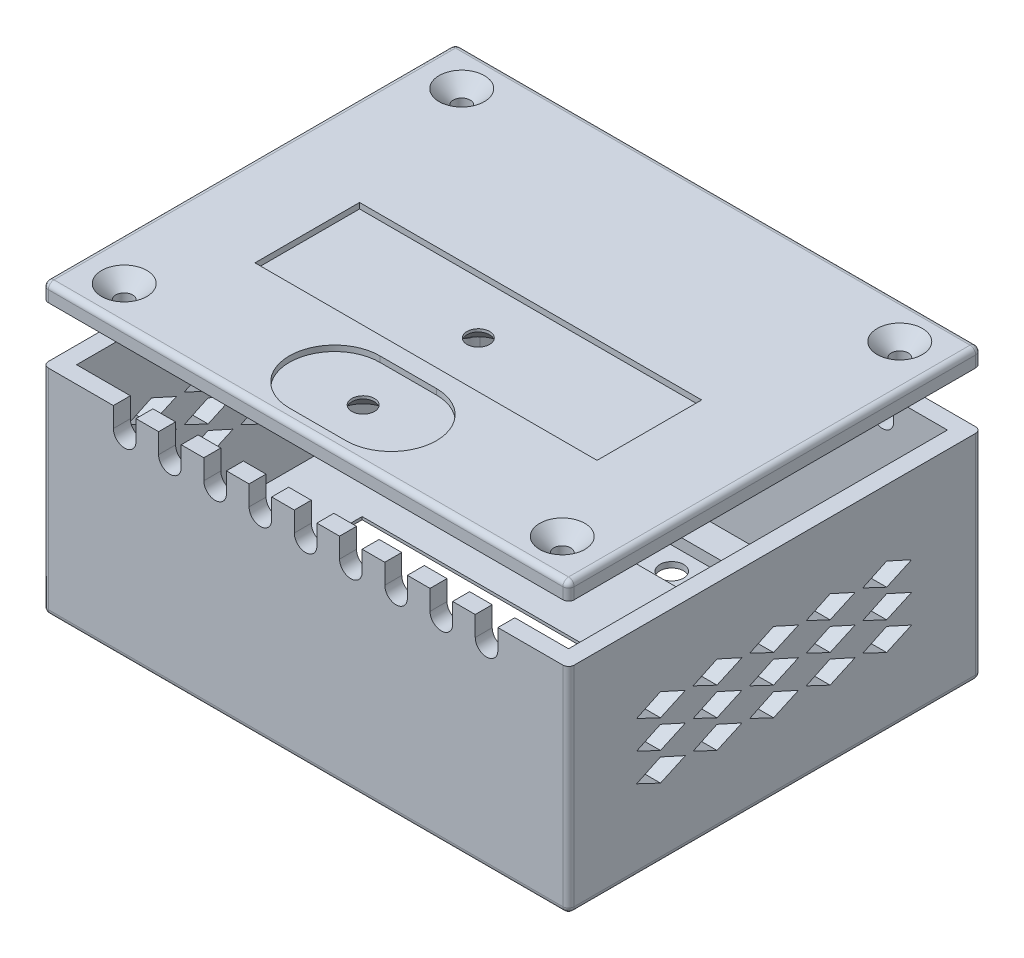
from build123d import *
from OCP.BRepFilletAPI import BRepFilletAPI_MakeChamfer

# Parameters (mm, degrees)
SKETCH_227_W            = 93
SKETCH_227_H            = 73
SKETCH_227_W_2          = 87
SKETCH_227_H_2          = 67
EXTRUDE_477_DEPTH       = 35
SKETCH_2_W              = 93
SKETCH_2_H              = 73
EXTRUDE_524_DEPTH       = 3
SKETCH_1_W              = 60
SKETCH_1_H              = 31
CUT_EXTRUDE_2861_DEPTH  = 3
EXTRUDE_3757_DEPTH      = 2
EXTRUDE_3757_DEPTH_BACK = 3
SKETCH_2_2_R            = 3
SKETCH_2_2_R_2          = 1.5
CHAMFER_3816_SIZE       = 2.5
CHAMFER_3816_SIZE2      = 3
SKETCH_1_3_W            = 28
SKETCH_1_3_H            = 8
CUT_EXTRUDE_1_DEPTH     = 2
SKETCH_1_4_R            = 2.1
CUT_EXTRUDE_2_DEPTH     = 69.698617162
SKETCH_1_5_R            = 1.25
EXTRUDE_3_DEPTH         = 5
FILLET_4_R              = 1
SKETCH_4282_R           = 1.5
EXTRUDE_5048_DEPTH      = 12
CUT_EXTRUDE_6380_DEPTH  = 129.932152701
CUT_EXTRUDE_7651_DEPTH  = 94.360859036
FILLET_2_R              = 1
SKETCH_7_W              = 93
SKETCH_7_H              = 73
SKETCH_7_R              = 1.5
EXTRUDE_8347_DEPTH      = 3
EXTRUDE_START           = -1
SKETCH_7_3_W            = 86
SKETCH_7_3_H            = 66
SKETCH_7_3_R            = 1.5
EXTRUDE_2_DEPTH         = 1
FILLET_3_R              = 1
CHAMFER_2_SIZE          = 2.5
SKETCH_4_W              = 60.5
SKETCH_4_H              = 18.5
CUT_EXTRUDE_1_2_DEPTH   = 1
SKETCH_4_3_R            = 2
CUT_EXTRUDE_2_2_DEPTH   = 5
CHAMFER_3_SIZE          = 2.5
SKETCH_8_W              = 2.198076923
SKETCH_8_H              = 1.058333334
CUT_EXTRUDE_10181_DEPTH = 1


with BuildPart() as part:
    # Sketch 227 → Extrude 477 (new body)
    with BuildSketch(Plane(origin=(0, 0, 0), x_dir=(1, 0, 0), z_dir=(0, 1, 0))):
        Rectangle(SKETCH_227_W, SKETCH_227_H)
        Rectangle(SKETCH_227_W_2, SKETCH_227_H_2, mode=Mode.SUBTRACT)
    extrude(amount=EXTRUDE_477_DEPTH)

    # Sketch 2 → Extrude 524 (add)
    with BuildSketch(Plane(origin=(0, 0, 0), x_dir=(1, 0, 0), z_dir=(0, 1, 0))):
        Rectangle(SKETCH_2_W, SKETCH_2_H)
    extrude(amount=-EXTRUDE_524_DEPTH)

    # Экран1 → Cut-Extrude 2861 (cut)
    with BuildSketch(Plane.XZ):
        with Locations((0, 12)):
            Rectangle(SKETCH_1_W, SKETCH_1_H)
    extrude(amount=CUT_EXTRUDE_2861_DEPTH, mode=Mode.SUBTRACT)

    # Sketch 2 2 → Extrude 3757 (add, two sides: drawn at the far end of the back side and taken through both)
    # profile 1 of 4: a face of its own
    with BuildSketch(Plane.XZ.offset(-EXTRUDE_3757_DEPTH_BACK)):
        with Locations((-32.75, -12.5)):
            Circle(SKETCH_2_2_R)
        with Locations((-32.75, -12.5)):
            Circle(SKETCH_2_2_R_2, mode=Mode.SUBTRACT)
    # profile 2 of 4: a face of its own
    with BuildSketch(Plane.XZ.offset(-EXTRUDE_3757_DEPTH_BACK)):
        with Locations((32.75, -12.5)):
            Circle(SKETCH_2_2_R)
        with Locations((32.75, -12.5)):
            Circle(SKETCH_2_2_R_2, mode=Mode.SUBTRACT)
    # profile 3 of 4: a face of its own
    with BuildSketch(Plane.XZ.offset(-EXTRUDE_3757_DEPTH_BACK)):
        with BuildLine():
            Line((29.75, 30.5), (29.75, 35.108230604))
            Line((29.75, 35.108230604), (35.75, 35.108230604))
            Line((35.75, 35.108230604), (35.75, 30.5))
            ThreePointArc((35.75, 30.5), (32.75, 27.5), (29.75, 30.5))
        make_face()
        with Locations((32.75, 30.5)):
            Circle(SKETCH_2_2_R_2, mode=Mode.SUBTRACT)
    # profile 4 of 4: a face of its own
    with BuildSketch(Plane.XZ.offset(-EXTRUDE_3757_DEPTH_BACK)):
        with BuildLine():
            Line((-35.75, 30.5), (-35.75, 35.108230604))
            Line((-35.75, 35.108230604), (-29.75, 35.108230604))
            Line((-29.75, 35.108230604), (-29.75, 30.5))
            ThreePointArc((-29.75, 30.5), (-32.75, 27.5), (-35.75, 30.5))
        make_face()
        with Locations((-32.75, 30.5)):
            Circle(SKETCH_2_2_R_2, mode=Mode.SUBTRACT)
    extrude(amount=EXTRUDE_3757_DEPTH + EXTRUDE_3757_DEPTH_BACK)

    # Chamfer 3816: one chamfer whose edges measure the first distance from different faces: ONE call of the kernel's chamfer builder (chamfer() names one face for all edges)
    chamfer_3816_edges_1 = [part.edges().sort_by_distance(p)[0] for p in [
        (0, -3, -3.5),
    ]]
    chamfer_3816_side_1 = [part.faces().sort_by_distance(p)[0] for p in [
        (0, -1.5, -3.5),
    ]]
    chamfer_3816_edges_2 = [part.edges().sort_by_distance(p)[0] for p in [
        (-30, -3, 12),
    ]]
    chamfer_3816_side_2 = [part.faces().sort_by_distance(p)[0] for p in [
        (-30, -1.5, 12),
    ]]
    chamfer_3816_edges_3 = [part.edges().sort_by_distance(p)[0] for p in [
        (30, -3, 12),
    ]]
    chamfer_3816_side_3 = [part.faces().sort_by_distance(p)[0] for p in [
        (30, -1.5, 12),
    ]]
    chamfer_3816_edges_4 = [part.edges().sort_by_distance(p)[0] for p in [
        (0, -3, 27.5),
    ]]
    chamfer_3816_side_4 = [part.faces().sort_by_distance(p)[0] for p in [
        (0, -1.5, 27.5),
    ]]
    chamfer_3816 = BRepFilletAPI_MakeChamfer(part.part.solid().wrapped)
    for e in chamfer_3816_edges_1:
        chamfer_3816.Add(CHAMFER_3816_SIZE, CHAMFER_3816_SIZE2, e.wrapped, chamfer_3816_side_1[0].wrapped)  # the first distance lies on this face
    for e in chamfer_3816_edges_2:
        chamfer_3816.Add(CHAMFER_3816_SIZE, CHAMFER_3816_SIZE2, e.wrapped, chamfer_3816_side_2[0].wrapped)  # the first distance lies on this face
    for e in chamfer_3816_edges_3:
        chamfer_3816.Add(CHAMFER_3816_SIZE, CHAMFER_3816_SIZE2, e.wrapped, chamfer_3816_side_3[0].wrapped)  # the first distance lies on this face
    for e in chamfer_3816_edges_4:
        chamfer_3816.Add(CHAMFER_3816_SIZE, CHAMFER_3816_SIZE2, e.wrapped, chamfer_3816_side_4[0].wrapped)  # the first distance lies on this face
    add(Compound.cast(chamfer_3816.Shape()), mode=Mode.REPLACE)

    # Экран1<3> → Cut-Extrude 1 (cut)
    with BuildSketch(Plane.XZ):
        with Locations((0, -24.5)):
            Rectangle(SKETCH_1_3_W, SKETCH_1_3_H)
    extrude(amount=CUT_EXTRUDE_1_DEPTH, mode=Mode.SUBTRACT)

    # Экран1<4> → Cut-Extrude 2 (cut, through all)
    with BuildSketch(Plane.XZ):
        with Locations((-11, -24.5)):
            Circle(SKETCH_1_4_R)
        with Locations((-3.75, -24.5)):
            Circle(SKETCH_1_4_R)
        with Locations((11, -24.5)):
            Circle(SKETCH_1_4_R)
        with Locations((3.75, -24.5)):
            Circle(SKETCH_1_4_R)
    extrude(amount=CUT_EXTRUDE_2_DEPTH, mode=Mode.SUBTRACT)

    # Экран1<5> → КН3 (add)
    with BuildSketch(Plane.XZ):
        with Locations((-16.5, -19)):
            Circle(SKETCH_1_5_R)
        with Locations((16.5, -19)):
            Circle(SKETCH_1_5_R)
        with Locations((16.5, -30)):
            Circle(SKETCH_1_5_R)
        with Locations((-16.5, -30)):
            Circle(SKETCH_1_5_R)
    extrude(amount=-EXTRUDE_3_DEPTH)

    # КН4
    fillet_4_edges = [part.edges().sort_by_distance(p)[0] for p in [
        (-17.75, 5, -30),
        (-17.75, 5, -19),
        (15.25, 5, -30),
        (15.25, 5, -19),
    ]]
    fillet(fillet_4_edges, radius=FILLET_4_R)

    # Sketch 4282 → Extrude 5048 (add)
    # profile 1 of 4: a face of its own
    with BuildSketch(Plane(origin=(0, 0, 0), x_dir=(1, 0, 0), z_dir=(0, 1, 0))):
        with BuildLine():
            Line((-35.485, -29.845), (-35.485, -34.239974432))
            Line((-35.485, -34.239974432), (-44.325235743, -34.239974432))
            Line((-44.325235743, -34.239974432), (-44.325235743, -26.595))
            Line((-44.325235743, -26.595), (-38.735, -26.595))
            ThreePointArc((-38.735, -26.595), (-36.436902961, -27.546902961), (-35.485, -29.845))
        make_face()
        with Locations((-38.735, -29.845)):
            Circle(SKETCH_4282_R, mode=Mode.SUBTRACT)
    # profile 2 of 4: a face of its own
    with BuildSketch(Plane(origin=(0, 0, 0), x_dir=(1, 0, 0), z_dir=(0, 1, 0))):
        with BuildLine():
            Line((44.325235743, -26.595), (44.325235743, -34.239974432))
            Line((44.325235743, -34.239974432), (35.485, -34.239974432))
            Line((35.485, -34.239974432), (35.485, -29.845))
            ThreePointArc((35.485, -29.845), (36.436902961, -27.546902961), (38.735, -26.595))
            Line((38.735, -26.595), (44.325235743, -26.595))
        make_face()
        with Locations((38.735, -29.845)):
            Circle(SKETCH_4282_R, mode=Mode.SUBTRACT)
    # profile 3 of 4: a face of its own
    with BuildSketch(Plane(origin=(0, 0, 0), x_dir=(1, 0, 0), z_dir=(0, 1, 0))):
        with BuildLine():
            Line((35.485, 29.845), (35.485, 34.239974432))
            Line((35.485, 34.239974432), (44.325235743, 34.239974432))
            Line((44.325235743, 34.239974432), (44.325235743, 26.595))
            Line((44.325235743, 26.595), (38.735, 26.595))
            ThreePointArc((38.735, 26.595), (36.436902961, 27.546902961), (35.485, 29.845))
        make_face()
        with Locations((38.735, 29.845)):
            Circle(SKETCH_4282_R, mode=Mode.SUBTRACT)
    # profile 4 of 4: a face of its own
    with BuildSketch(Plane(origin=(0, 0, 0), x_dir=(1, 0, 0), z_dir=(0, 1, 0))):
        with BuildLine():
            Line((-44.325235743, 26.595), (-44.325235743, 34.239974432))
            Line((-44.325235743, 34.239974432), (-35.485, 34.239974432))
            Line((-35.485, 34.239974432), (-35.485, 29.845))
            ThreePointArc((-35.485, 29.845), (-36.436902961, 27.546902961), (-38.735, 26.595))
            Line((-38.735, 26.595), (-44.325235743, 26.595))
        make_face()
        with Locations((-38.735, 29.845)):
            Circle(SKETCH_4282_R, mode=Mode.SUBTRACT)
    extrude(amount=EXTRUDE_5048_DEPTH)

    # Sketch 5098 → Cut-Extrude 6380 (cut, through all)
    with BuildSketch(Plane(origin=(-46.5, -46.5, 0), x_dir=(0, -1, 0), z_dir=(1, 0, 0))):
        Polygon((-57.799499658, -14.466543213), (-55.799499658, -10.243903766), (-57.799499658, -5.835537696), (-59.799499658, -10.243903766), align=None)
        Polygon((-57.799499658, -24.466543213), (-55.799499658, -20.243903766), (-57.799499658, -15.835537696), (-59.799499658, -20.243903766), align=None)
        Polygon((-62.799499658, -24.466543213), (-60.799499658, -20.243903766), (-62.799499658, -15.835537696), (-64.799499658, -20.243903766), align=None)
        Polygon((-67.799499658, -24.466543213), (-65.799499658, -20.243903766), (-67.799499658, -15.835537696), (-69.799499658, -20.243903766), align=None)
        Polygon((-62.799499658, -14.466543213), (-60.799499658, -10.243903766), (-62.799499658, -5.835537696), (-64.799499658, -10.243903766), align=None)
        Polygon((-67.799499658, -14.466543213), (-65.799499658, -10.243903766), (-67.799499658, -5.835537696), (-69.799499658, -10.243903766), align=None)
        Polygon((-57.799499658, -4.466543213), (-55.799499658, -0.243903766), (-57.799499658, 4.164462304), (-59.799499658, -0.243903766), align=None)
        Polygon((-62.799499658, -4.466543213), (-60.799499658, -0.243903766), (-62.799499658, 4.164462304), (-64.799499658, -0.243903766), align=None)
        Polygon((-67.799499658, -4.466543213), (-65.799499658, -0.243903766), (-67.799499658, 4.164462304), (-69.799499658, -0.243903766), align=None)
        Polygon((-57.799499658, 5.533456787), (-55.799499658, 9.756096234), (-57.799499658, 14.164462304), (-59.799499658, 9.756096234), align=None)
        Polygon((-62.799499658, 5.533456787), (-60.799499658, 9.756096234), (-62.799499658, 14.164462304), (-64.799499658, 9.756096234), align=None)
        Polygon((-67.799499658, 5.533456787), (-65.799499658, 9.756096234), (-67.799499658, 14.164462304), (-69.799499658, 9.756096234), align=None)
        Polygon((-57.799499658, 15.533456787), (-55.799499658, 19.756096234), (-57.799499658, 24.164462304), (-59.799499658, 19.756096234), align=None)
        Polygon((-62.799499658, 15.533456787), (-60.799499658, 19.756096234), (-62.799499658, 24.164462304), (-64.799499658, 19.756096234), align=None)
        Polygon((-67.799499658, 15.533456787), (-65.799499658, 19.756096234), (-67.799499658, 24.164462304), (-69.799499658, 19.756096234), align=None)
    extrude(amount=CUT_EXTRUDE_6380_DEPTH, mode=Mode.SUBTRACT)

    # Эскиз6 → Cut-Extrude 7651 (cut, through all)
    with BuildSketch(Plane(origin=(0, 0, -36.5), x_dir=(-1, 0, 0), z_dir=(0, 0, -1))):
        with BuildLine():
            Line((2, 31.480713366), (2, 35))
            Line((2, 35), (-2, 35))
            Line((-2, 35), (-2, 31.480713366))
            ThreePointArc((-2, 31.480713366), (0, 29.480713366), (2, 31.480713366))
        make_face()
        with BuildLine():
            Line((10, 31.480713366), (10, 35))
            Line((10, 35), (6, 35))
            Line((6, 35), (6, 31.480713366))
            ThreePointArc((6, 31.480713366), (8, 29.480713366), (10, 31.480713366))
        make_face()
        with BuildLine():
            Line((18, 31.480713366), (18, 35))
            Line((18, 35), (14, 35))
            Line((14, 35), (14, 31.480713366))
            ThreePointArc((14, 31.480713366), (16, 29.480713366), (18, 31.480713366))
        make_face()
        with BuildLine():
            Line((26, 31.480713366), (26, 35))
            Line((26, 35), (22, 35))
            Line((22, 35), (22, 31.480713366))
            ThreePointArc((22, 31.480713366), (24, 29.480713366), (26, 31.480713366))
        make_face()
        with BuildLine():
            Line((34, 31.480713366), (34, 35))
            Line((34, 35), (30, 35))
            Line((30, 35), (30, 31.480713366))
            ThreePointArc((30, 31.480713366), (32, 29.480713366), (34, 31.480713366))
        make_face()
        with BuildLine():
            Line((-6, 31.480713366), (-6, 35))
            Line((-6, 35), (-10, 35))
            Line((-10, 35), (-10, 31.480713366))
            ThreePointArc((-10, 31.480713366), (-8, 29.480713366), (-6, 31.480713366))
        make_face()
        with BuildLine():
            Line((-14, 31.480713366), (-14, 35))
            Line((-14, 35), (-18, 35))
            Line((-18, 35), (-18, 31.480713366))
            ThreePointArc((-18, 31.480713366), (-16, 29.480713366), (-14, 31.480713366))
        make_face()
        with BuildLine():
            Line((-22, 31.480713366), (-22, 35))
            Line((-22, 35), (-26, 35))
            Line((-26, 35), (-26, 31.480713366))
            ThreePointArc((-26, 31.480713366), (-24, 29.480713366), (-22, 31.480713366))
        make_face()
        with BuildLine():
            Line((-30, 31.480713366), (-30, 35))
            Line((-30, 35), (-34, 35))
            Line((-34, 35), (-34, 31.480713366))
            ThreePointArc((-34, 31.480713366), (-32, 29.480713366), (-30, 31.480713366))
        make_face()
    extrude(amount=-CUT_EXTRUDE_7651_DEPTH, mode=Mode.SUBTRACT)

    # Скругление2
    fillet_2_edges = [part.edges().sort_by_distance(p)[0] for p in [
        (-46.5, 16, 36.5),
        (-46.5, 16, -36.5),
        (46.5, 16, -36.5),
        (46.5, 16, 36.5),
        (46.5, -3, 0),
        (0, -3, 36.5),
        (-46.5, -3, 0),
        (0, -3, -36.5),
    ]]
    fillet(fillet_2_edges, radius=FILLET_2_R)

    # Эскиз8 → Cut-Extrude 10181 (cut)
    with BuildSketch(Plane.XZ.offset(3)):
        with Locations((-10.962688555, -15.117212682)):
            Rectangle(SKETCH_8_W, SKETCH_8_H)
        Polygon((-4.571983426, -13.855353708), (-4.571983426, -12.308558836), (-3.513650093, -12.308558836), (-3.513650093, -13.855353708), (-1.885444964, -13.855353708), (-1.885444964, -14.913687041), (-3.513650093, -14.913687041), (-3.513650093, -16.460481913), (-4.571983426, -16.460481913), (-4.571983426, -14.913687041), (-6.200188554, -14.913687041), (-6.200188554, -13.855353708), align=None)
        Polygon((1.778016574, -11.08740499), (5.197247343, -11.08740499), (5.197247343, -12.227148579), (2.917760164, -12.227148579), (2.917760164, -13.448302426), (5.197247343, -13.448302426), (5.197247343, -14.588046015), (2.917760164, -14.588046015), (2.917760164, -16.2976614), (5.197247343, -16.2976614), (5.197247343, -17.43740499), (1.778016574, -17.43740499), align=None)
        with BuildLine():
            Line((12.035708882, -11.935852506), (11.18344526, -12.715610118))
            add(Edge.make_bspline(
                [(11.18344526, -12.715610118), (11.115240811, -12.615550509), (11.008085728, -12.477394122), (10.850124863, -12.319945746), (10.73652598, -12.226881626), (10.621344292, -12.154472729), (10.469317172, -12.086967955), (10.349028438, -12.064069056), (10.270123946, -12.064328067)],
                knots=[0, 0, 0, 0, 0.31182434, 0.448432767, 0.573381197, 0.689077147, 0.797572901, 1, 1, 1, 1], degree=3))
            add(Edge.make_bspline(
                [(10.270123946, -12.064328067), (10.200756629, -12.064216406), (10.097367838, -12.07659847), (9.976136925, -12.134449077), (9.89898156, -12.189349936), (9.837949237, -12.255546776), (9.773768086, -12.346429195), (9.756826865, -12.428031448), (9.756221702, -12.480283595)],
                knots=[0, 0, 0, 0, 0.285992887, 0.416634394, 0.547379946, 0.671582838, 0.784400739, 1, 1, 1, 1], degree=3))
            add(Edge.make_bspline(
                [(9.756221702, -12.480283595), (9.755439866, -12.533591008), (9.775703689, -12.642360428), (9.828641503, -12.739272153), (9.861800628, -12.784300022)],
                knots=[0, 0, 0, 0, 0.487115475, 1, 1, 1, 1], degree=3))
            add(Edge.make_bspline(
                [(9.861800628, -12.784300022), (9.894291342, -12.827692703), (9.957541757, -12.89570312), (10.054651171, -12.994699744), (10.154583283, -13.089388399), (10.269935168, -13.199711266), (10.462336858, -13.371950384), (10.615262197, -13.508617667), (10.724240532, -13.603490727)],
                knots=[0, 0, 0, 0, 0.136349281, 0.233805212, 0.349411224, 0.48317915, 0.635966856, 1, 1, 1, 1], degree=3))
            add(Edge.make_bspline(
                [(10.724240532, -13.603490727), (10.825342822, -13.691530368), (10.970308098, -13.815212262), (11.150016864, -13.973999674), (11.261144287, -14.071853987), (11.354942775, -14.156575621), (11.447206517, -14.24283398), (11.507829464, -14.300959754), (11.542159202, -14.336183035)],
                knots=[0, 0, 0, 0, 0.366184141, 0.520457298, 0.655012135, 0.770624226, 0.865677185, 1, 1, 1, 1], degree=3))
            add(Edge.make_bspline(
                [(11.542159202, -14.336183035), (11.651612031, -14.451024729), (11.800953763, -14.624852553), (11.961298441, -14.870676904), (12.050521547, -15.046105508), (12.117801202, -15.223115993), (12.182176427, -15.469812234), (12.198660262, -15.662666024), (12.198529395, -15.792663403)],
                knots=[0, 0, 0, 0, 0.289954183, 0.417138648, 0.535255184, 0.648751095, 0.762405462, 1, 1, 1, 1], degree=3))
            add(Edge.make_bspline(
                [(12.198529395, -15.792663403), (12.200576028, -15.918626233), (12.182059541, -16.104100364), (12.128833168, -16.342979319), (12.06869062, -16.509377766), (11.995269163, -16.66867708), (11.90325735, -16.818399914), (11.795193751, -16.960060421), (11.671338496, -17.091126644), (11.534339296, -17.210059822), (11.387394734, -17.315938128), (11.229067989, -17.403349819), (11.060710835, -17.475343494), (10.882417201, -17.530731457), (10.626733213, -17.586725535), (10.427039058, -17.600475804), (10.291748545, -17.600225503)],
                knots=[0, 0, 0, 0, 0.127926544, 0.18904691, 0.248543693, 0.307607127, 0.36724766, 0.426963056, 0.488617128, 0.550391855, 0.611330734, 0.672556085, 0.734024191, 0.797340621, 0.862249627, 1, 1, 1, 1], degree=3))
            add(Edge.make_bspline(
                [(10.291748545, -17.600225503), (10.184208526, -17.600143707), (10.024968064, -17.5907372), (9.818261956, -17.556603583), (9.670805317, -17.520600676), (9.528307669, -17.474926661), (9.390763876, -17.419151274), (9.259123267, -17.352395265), (9.13238981, -17.276035293), (9.011179669, -17.187371033), (8.893959828, -17.0882156), (8.781896033, -16.977043377), (8.674444543, -16.854119192), (8.572314639, -16.719087484), (8.435743295, -16.52121715), (8.347992614, -16.359269417), (8.290837087, -16.248052025)],
                knots=[0, 0, 0, 0, 0.125868382, 0.18624025, 0.244976651, 0.303357688, 0.361230317, 0.418489049, 0.475936712, 0.534203744, 0.594059429, 0.655468694, 0.718771685, 0.784974607, 0.853522316, 1, 1, 1, 1], degree=3))
            Line((8.290837087, -16.248052025), (9.293200869, -15.646379349))
            add(Edge.make_bspline(
                [(9.293200869, -15.646379349), (9.361469405, -15.771068857), (9.472477146, -15.943744458), (9.64459515, -16.141620204), (9.773512249, -16.257263568), (9.906699264, -16.347952859), (10.088804052, -16.434136584), (10.236310575, -16.460682832), (10.333725709, -16.460481913)],
                knots=[0, 0, 0, 0, 0.307611547, 0.442138888, 0.566229194, 0.681222208, 0.789558005, 1, 1, 1, 1], degree=3))
            add(Edge.make_bspline(
                [(10.333725709, -16.460481913), (10.429502223, -16.461207907), (10.570599406, -16.439461065), (10.741352188, -16.362483802), (10.849852481, -16.282332714), (10.941544136, -16.189699539), (11.031436893, -16.054062109), (11.060144416, -15.936328883), (11.058785805, -15.858809236)],
                knots=[0, 0, 0, 0, 0.275473311, 0.404345843, 0.535429711, 0.661427401, 0.77786684, 1, 1, 1, 1], degree=3))
            add(Edge.make_bspline(
                [(11.058785805, -15.858809236), (11.058615544, -15.785005563), (11.036362804, -15.6726417), (10.972170718, -15.530138494), (10.914405955, -15.440407689), (10.855509504, -15.365283169), (10.799209884, -15.300190301), (10.730645479, -15.22827453), (10.649997982, -15.149444107), (10.558327418, -15.063009361), (10.414517994, -14.931385872), (10.298153408, -14.832067501), (10.216698465, -14.763586881)],
                knots=[0, 0, 0, 0, 0.155090822, 0.238351561, 0.32840414, 0.37938386, 0.439617644, 0.509831416, 0.588874645, 0.677436354, 0.77554672, 1, 1, 1, 1], degree=3))
            add(Edge.make_bspline(
                [(10.216698465, -14.763586881), (10.061007329, -14.633009727), (9.839520038, -14.441716642), (9.564007216, -14.188908842), (9.389855374, -14.018183063), (9.236884824, -13.861037927), (9.106114494, -13.71621255), (8.998997113, -13.582585777), (8.886241248, -13.424315555), (8.77932097, -13.231443051), (8.65738071, -12.928237824), (8.614811461, -12.691081763), (8.616478112, -12.534981111)],
                knots=[0, 0, 0, 0, 0.215201009, 0.309902452, 0.395959096, 0.473447494, 0.542140328, 0.602523333, 0.654726333, 0.747804055, 0.835278417, 1, 1, 1, 1], degree=3))
            add(Edge.make_bspline(
                [(8.616478112, -12.534981111), (8.615850369, -12.427822127), (8.631890043, -12.26894415), (8.681003872, -12.064070354), (8.73347654, -11.918190994), (8.801683347, -11.778575245), (8.88449146, -11.644537917), (8.983215615, -11.517313145), (9.094469186, -11.396985043), (9.217042636, -11.287019151), (9.34802786, -11.189962164), (9.486683397, -11.107990284), (9.632161853, -11.039974347), (9.785361418, -10.987965691), (10.001490216, -10.93783509), (10.169618127, -10.925288006), (10.282844298, -10.924584477)],
                knots=[0, 0, 0, 0, 0.12445736, 0.184840915, 0.244566821, 0.304319173, 0.365199786, 0.427420983, 0.491261689, 0.555499002, 0.618604518, 0.680494764, 0.742473305, 0.804990665, 0.868251971, 1, 1, 1, 1], degree=3))
            add(Edge.make_bspline(
                [(10.282844298, -10.924584477), (10.431940641, -10.924659189), (10.655532282, -10.952646401), (10.942314768, -11.042551954), (11.115763626, -11.123333095), (11.253772586, -11.201703517), (11.359543989, -11.273839833), (11.467170855, -11.35648161), (11.577527208, -11.449878883), (11.688537821, -11.555812912), (11.846248865, -11.714820449), (11.960539675, -11.844423566), (12.035708882, -11.935852506)],
                knots=[0, 0, 0, 0, 0.212976528, 0.319776676, 0.428556273, 0.485856803, 0.546558687, 0.611431498, 0.67982091, 0.753158505, 0.830752869, 1, 1, 1, 1], degree=3))
        make_face()
    extrude(amount=-CUT_EXTRUDE_10181_DEPTH, mode=Mode.SUBTRACT)


with BuildPart() as body_2:
    # Эскиз7 → Extrude 8347 (new body)
    with BuildSketch(Plane(origin=(0, 45, 0), x_dir=(1, 0, 0), z_dir=(0, 1, 0))):
        Rectangle(SKETCH_7_W, SKETCH_7_H)
        with Locations((-38.735, 29.845)):
            Circle(SKETCH_7_R, mode=Mode.SUBTRACT)
        with Locations((38.735, 29.845)):
            Circle(SKETCH_7_R, mode=Mode.SUBTRACT)
        with Locations((38.735, -29.845)):
            Circle(SKETCH_7_R, mode=Mode.SUBTRACT)
        with Locations((-38.735, -29.845)):
            Circle(SKETCH_7_R, mode=Mode.SUBTRACT)
    extrude(amount=EXTRUDE_8347_DEPTH)

    # Эскиз7<3> → Верхняя крышка 2 (add)
    with BuildSketch(Plane(origin=(0, 45, 0), x_dir=(1, 0, 0), z_dir=(0, 1, 0)).offset(EXTRUDE_START)):
        Rectangle(SKETCH_7_3_W, SKETCH_7_3_H)
        with Locations((-38.735, 29.845)):
            Circle(SKETCH_7_3_R, mode=Mode.SUBTRACT)
        with Locations((38.735, 29.845)):
            Circle(SKETCH_7_3_R, mode=Mode.SUBTRACT)
        with Locations((38.735, -29.845)):
            Circle(SKETCH_7_3_R, mode=Mode.SUBTRACT)
        with Locations((-38.735, -29.845)):
            Circle(SKETCH_7_3_R, mode=Mode.SUBTRACT)
    extrude(amount=EXTRUDE_2_DEPTH)

    # Скругление3
    fillet_3_edges = [body_2.edges().sort_by_distance(p)[0] for p in [
        (-46.5, 46.5, 36.5),
        (46.5, 46.5, 36.5),
        (46.5, 46.5, -36.5),
        (-46.5, 46.5, -36.5),
        (-46.5, 48, 0),
        (0, 48, 36.5),
        (46.5, 48, 0),
        (0, 48, -36.5),
    ]]
    fillet(fillet_3_edges, radius=FILLET_3_R)

    # Фаска2
    chamfer_2_edges = [body_2.edges().sort_by_distance(p)[0] for p in [
        (37.235, 48, -29.845),
        (-40.235, 48, -29.845),
        (-40.235, 48, 29.845),
        (37.235, 48, 29.845),
    ]]
    chamfer(chamfer_2_edges, length=CHAMFER_2_SIZE)

    # Эскиз4 → Cut-Extrude 1 2 (cut)
    with BuildSketch(Plane(origin=(0, 48, 0), x_dir=(-1, 0, 0), z_dir=(0, 1, 0))):
        with BuildLine():
            Line((5.049026441, 18.319021753), (-4.950973559, 18.319021753))
            ThreePointArc((-4.950973559, 18.319021753), (-12.950973559, 26.319021753), (-4.950973559, 34.319021753))
            Line((-4.950973559, 34.319021753), (5.049026441, 34.319021753))
            ThreePointArc((5.049026441, 34.319021753), (13.049026441, 26.319021753), (5.049026441, 18.319021753))
        make_face()
        with Locations((0.085418977, 5.873619308)):
            Rectangle(SKETCH_4_W, SKETCH_4_H)
    extrude(amount=-CUT_EXTRUDE_1_2_DEPTH, mode=Mode.SUBTRACT)

    # Эскиз4<3> → Cut-Extrude 2 2 (cut)
    with BuildSketch(Plane(origin=(0, 48, 0), x_dir=(-1, 0, 0), z_dir=(0, 1, 0))):
        with Locations((0, 26.319021753)):
            Circle(SKETCH_4_3_R)
        with Locations((0.085418977, 5.873619308)):
            Circle(SKETCH_4_3_R)
    extrude(amount=-CUT_EXTRUDE_2_2_DEPTH, mode=Mode.SUBTRACT)

    # Фаска3
    chamfer_3_edges = [body_2.edges().sort_by_distance(p)[0] for p in [
        (1.914581023, 44, 5.873619308),
        (2, 44, 26.319021753),
    ]]
    chamfer(chamfer_3_edges, length=CHAMFER_3_SIZE)


solid = Compound([part.part, body_2.part])
